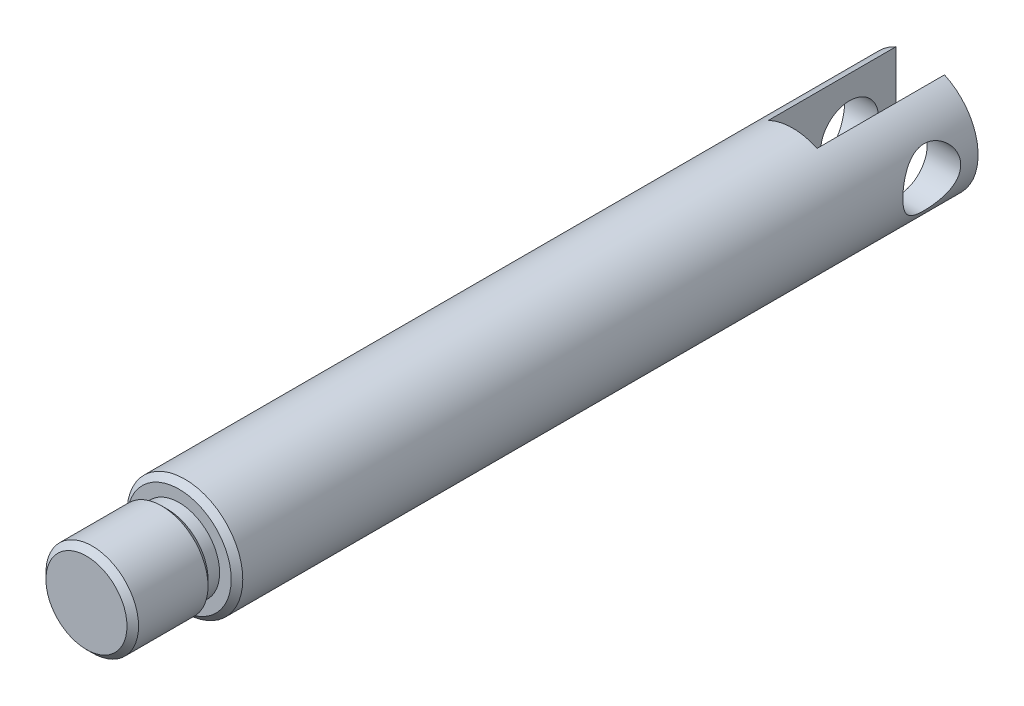
from build123d import *

# Parameters (mm, degrees)
SKETCH1_R               = 2.5
BOSS_EXTRUDE1_DEPTH     = 32
SKETCH2_R               = 1.75
BOSS_EXTRUDE2_DEPTH     = 0.5
SKETCH4_R               = 2
BOSS_EXTRUDE3_DEPTH     = 3.5
CHAMFER1_SIZE           = 0.25
CUT_EXTRUDE1_DEPTH      = 37.173194495
CUT_EXTRUDE1_DEPTH_BACK = 37.173194495
SKETCH5_R               = 1.25
CUT_EXTRUDE2_DEPTH      = 37.173194509
CUT_EXTRUDE2_DEPTH_BACK = 37.173194509
SKETCH6_W               = 2.1
SKETCH6_H               = 5.5


with BuildPart() as part:
    # Sketch1 → Boss-Extrude1 (new body)
    with BuildSketch(Plane.XY):
        Circle(SKETCH1_R)
    extrude(amount=BOSS_EXTRUDE1_DEPTH)

    # Sketch2 → Boss-Extrude2 (add)
    with BuildSketch(Plane.XY.offset(32)):
        Circle(SKETCH2_R)
    extrude(amount=BOSS_EXTRUDE2_DEPTH)

    # Sketch4 → Boss-Extrude3 (add)
    with BuildSketch(Plane.XY.offset(32.5)):
        Circle(SKETCH4_R)
    extrude(amount=BOSS_EXTRUDE3_DEPTH)

    # Chamfer1
    chamfer1_edges = [part.edges().sort_by_distance(p)[0] for p in [
        (-2, 0, 32.5),
        (-2, 0, 36),
        (-2.5, 0, 32),
    ]]
    chamfer(chamfer1_edges, length=CHAMFER1_SIZE - 0.0001)  # a hair under: the kernel refuses the full size

    # Sketch5 → Cut-Extrude1 (cut, two sides: drawn at the far end of the back side and taken through both)
    with BuildSketch(Plane(origin=(0, 0, 0), x_dir=(0, 0, -1), z_dir=(1, 0, 0)).offset(-CUT_EXTRUDE1_DEPTH_BACK)):
        with Locations((-2, 0)):
            Circle(SKETCH5_R)
    extrude(amount=CUT_EXTRUDE1_DEPTH + CUT_EXTRUDE1_DEPTH_BACK, mode=Mode.SUBTRACT)

    # Sketch6 → Cut-Extrude2 (cut, two sides: drawn at the far end of the back side and taken through both)
    with BuildSketch(Plane(origin=(0, 0, 0), x_dir=(1, 0, 0), z_dir=(0, 1, 0)).offset(-CUT_EXTRUDE2_DEPTH_BACK)):
        with Locations((0, -2.75)):
            Rectangle(SKETCH6_W, SKETCH6_H)
    extrude(amount=CUT_EXTRUDE2_DEPTH + CUT_EXTRUDE2_DEPTH_BACK, mode=Mode.SUBTRACT)


solid = part.part
